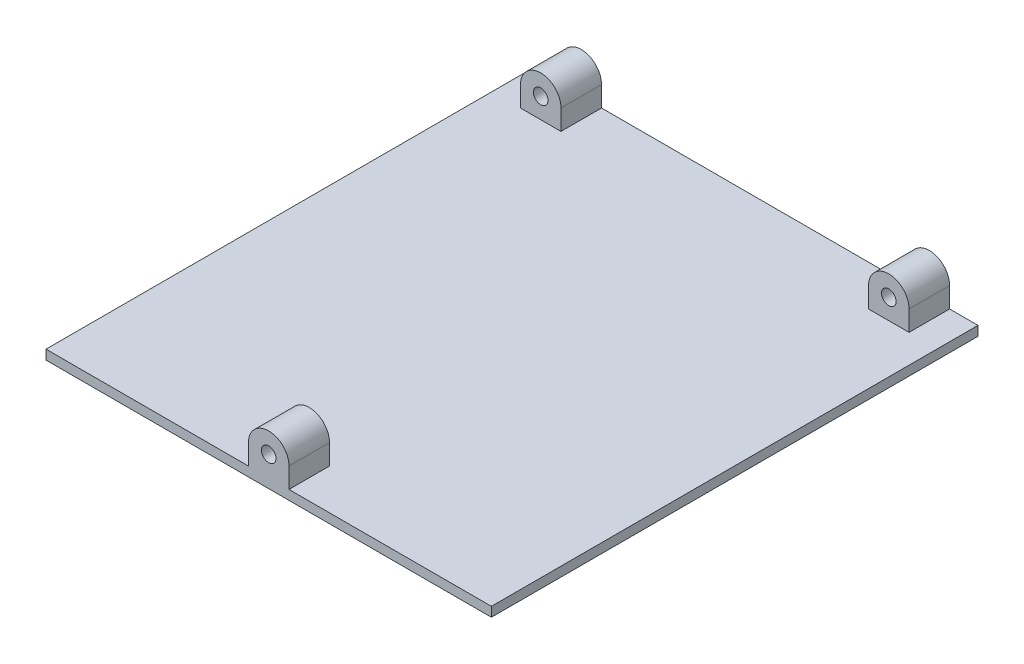
from build123d import *

# Parameters (mm, degrees)
SKETCH1_W           = 139.5
SKETCH1_H           = 152.4
BOSS_EXTRUDE1_DEPTH = 6.35
SKETCH2_W           = 139.5
SKETCH2_H           = 152.4
CUT_EXTRUDE1_DEPTH  = 3.375
SKETCH3_R           = 2.286
BOSS_EXTRUDE2_DEPTH = 12.7
SKETCH4_R           = 2.286
BOSS_EXTRUDE3_DEPTH = 12.7


with BuildPart() as part:
    # Sketch1 → Boss-Extrude1 (new body)
    with BuildSketch(Plane(origin=(0, 0, 0), x_dir=(1, 0, 0), z_dir=(0, 1, 0))):
        with Locations((69.75, 76.2)):
            Rectangle(SKETCH1_W, SKETCH1_H)
    extrude(amount=BOSS_EXTRUDE1_DEPTH)

    # Sketch2 → Cut-Extrude1 (cut)
    with BuildSketch(Plane(origin=(0, 6.35, 0), x_dir=(1, 0, 0), z_dir=(0, 1, 0))):
        with Locations((69.75, 76.2)):
            Rectangle(SKETCH2_W, SKETCH2_H)
    extrude(amount=-CUT_EXTRUDE1_DEPTH, mode=Mode.SUBTRACT)

    # Sketch3 → Boss-Extrude2 (add)
    with BuildSketch(Plane.XY):
        with BuildLine():
            Line((63.4, 9.325), (63.4, 2.975))
            Line((63.4, 2.975), (76.1, 2.975))
            Line((76.1, 2.975), (76.1, 9.325000158))
            ThreePointArc((76.1, 9.325000158), (69.749999921, 15.675000158), (63.4, 9.325))
        make_face()
        with Locations((69.75, 9.325000158)):
            Circle(SKETCH3_R, mode=Mode.SUBTRACT)
    extrude(amount=-BOSS_EXTRUDE2_DEPTH)

    # Sketch4 → Boss-Extrude3 (add)
    # profile 1 of 2: a face of its own
    with BuildSketch(Plane(origin=(0, 0, -152.4), x_dir=(-1, 0, 0), z_dir=(0, 0, -1))):
        with BuildLine():
            Line((-130.61, 9.325), (-130.61, 2.975))
            Line((-130.61, 2.975), (-117.91, 2.975))
            Line((-117.91, 2.975), (-117.91, 9.325))
            ThreePointArc((-117.91, 9.325), (-124.26, 15.675), (-130.61, 9.325))
        make_face()
        with Locations((-124.26, 9.325)):
            Circle(SKETCH4_R, mode=Mode.SUBTRACT)
    # profile 2 of 2: a face of its own
    with BuildSketch(Plane(origin=(0, 0, -152.4), x_dir=(-1, 0, 0), z_dir=(0, 0, -1))):
        with BuildLine():
            Line((-21.59, 9.325), (-21.59, 2.975))
            Line((-21.59, 2.975), (-8.89, 2.975))
            Line((-8.89, 2.975), (-8.89, 9.325))
            ThreePointArc((-8.89, 9.325), (-15.24, 15.675), (-21.59, 9.325))
        make_face()
        with Locations((-15.24, 9.325)):
            Circle(SKETCH4_R, mode=Mode.SUBTRACT)
    extrude(amount=-BOSS_EXTRUDE3_DEPTH)


solid = part.part
